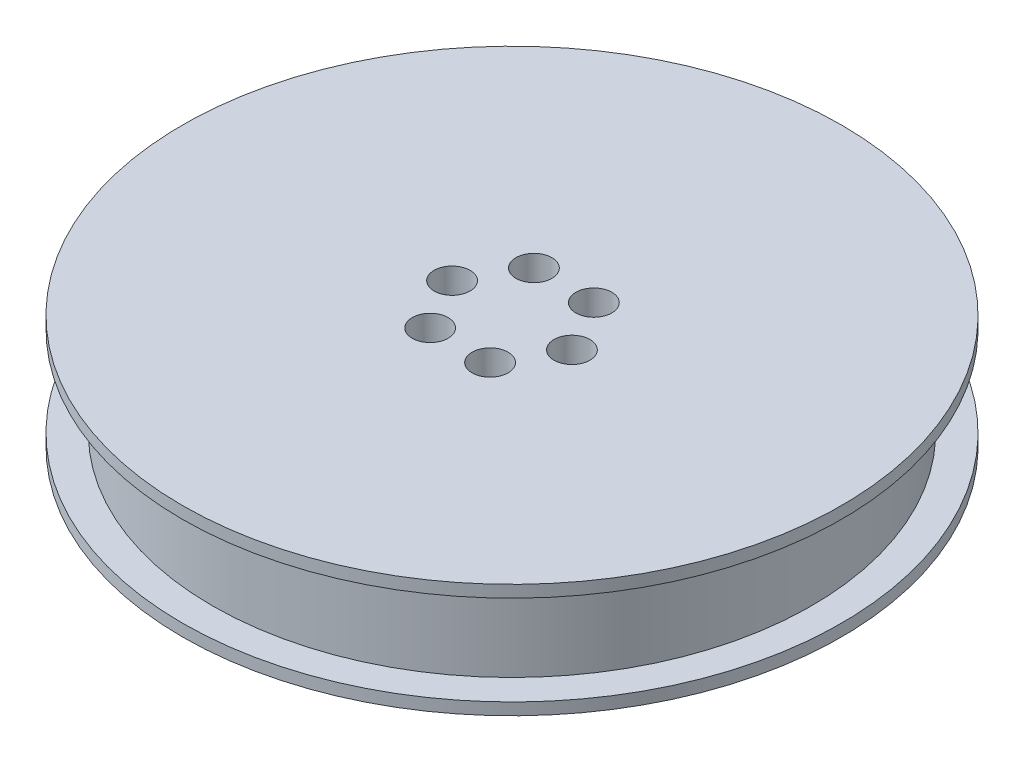
from build123d import *

# Parameters (mm, degrees)
SKETCH1_R           = 50
BOSS_EXTRUDE1_DEPTH = 7.5
SKETCH2_R           = 55
BOSS_EXTRUDE2_DEPTH = 2
SKETCH3_R           = 1.7
CUT_EXTRUDE1_DEPTH  = 81.068720484
SKETCH4_R           = 3
CUT_EXTRUDE2_DEPTH  = 5


with BuildPart() as part:
    # Sketch1 → Boss-Extrude1 (new, symmetric)
    with BuildSketch(Plane(origin=(0, 0, 0), x_dir=(1, 0, 0), z_dir=(0, 1, 0))):
        Circle(SKETCH1_R)
    extrude(amount=BOSS_EXTRUDE1_DEPTH, both=True)

    # Sketch2 → Boss-Extrude2 (add)
    with BuildSketch(Plane(origin=(0, 7.5, 0), x_dir=(1, 0, 0), z_dir=(0, 1, 0))):
        Circle(SKETCH2_R)
    boss_extrude2 = extrude(amount=BOSS_EXTRUDE2_DEPTH)

    # Mirror1: Boss-Extrude2 across plane
    add(boss_extrude2.mirror(Plane.ZX))

    # Sketch3 → Cut-Extrude1 (cut, through all)
    with BuildSketch(Plane(origin=(0, 9.5, 0), x_dir=(1, 0, 0), z_dir=(0, 1, 0))):
        with Locations((10, 0)):
            Circle(SKETCH3_R)
        with Locations((5, -8.660254038)):
            Circle(SKETCH3_R)
        with Locations((-5, -8.660254038)):
            Circle(SKETCH3_R)
        with Locations((-10, 0)):
            Circle(SKETCH3_R)
        with Locations((-5, 8.660254038)):
            Circle(SKETCH3_R)
        with Locations((5, 8.660254038)):
            Circle(SKETCH3_R)
    extrude(amount=-CUT_EXTRUDE1_DEPTH, mode=Mode.SUBTRACT)

    # Sketch4 → Cut-Extrude2 (cut)
    with BuildSketch(Plane(origin=(0, 9.5, 0), x_dir=(1, 0, 0), z_dir=(0, 1, 0))):
        with Locations((5, -8.660254038)):
            Circle(SKETCH4_R)
        with Locations((-5, -8.660254038)):
            Circle(SKETCH4_R)
        with Locations((-10, 0)):
            Circle(SKETCH4_R)
        with Locations((-5, 8.660254038)):
            Circle(SKETCH4_R)
        with Locations((5, 8.660254038)):
            Circle(SKETCH4_R)
        with Locations((10, 0)):
            Circle(SKETCH4_R)
    extrude(amount=-CUT_EXTRUDE2_DEPTH, mode=Mode.SUBTRACT)


solid = part.part
